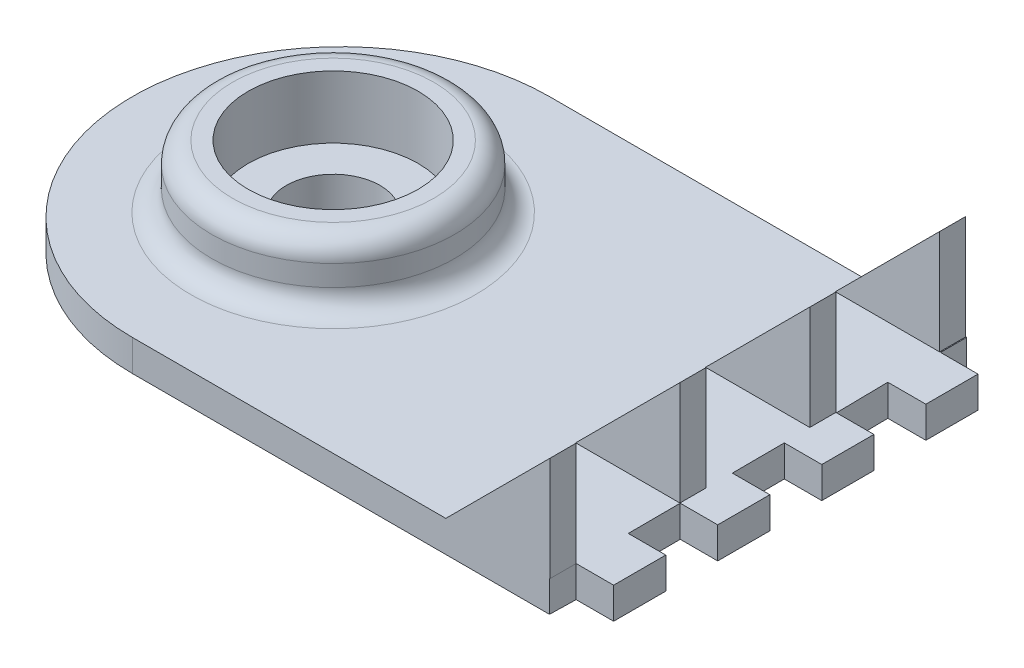
from build123d import *

# Parameters (mm, degrees)
BOSS_EXTRUDE1_DEPTH = 3
BOSS_EXTRUDE3_DEPTH = 2.5
LPATTERN2_COUNT     = 4
LPATTERN2_PITCH     = 12.5
SKETCH3_R           = 11.65
SKETCH3_R_2         = 8.15
BOSS_EXTRUDE4_DEPTH = 6
SKETCH4_R           = 4.5
CUT_EXTRUDE2_DEPTH  = 47.572524089
FILLET1_R           = 2
FILLET2_R           = 2


with BuildPart() as part:
    # Sketch1 → Boss-Extrude1 (new body)
    with BuildSketch(Plane(origin=(0, 0, 0), x_dir=(1, 0, 0), z_dir=(0, 1, 0))):
        with BuildLine():
            Line((20, 17.5), (23.592842073, 17.5))
            Line((23.592842073, 17.5), (23.592842073, 12.5))
            Line((23.592842073, 12.5), (19.944472227, 12.5))
            Line((19.944472227, 12.5), (20.019420438, 7.500018858))
            Line((20.019420438, 7.500018858), (23.612262511, 7.500018858))
            Line((23.612262511, 7.500018858), (23.612262511, 2.500018858))
            Line((23.612262511, 2.500018858), (20.019420438, 2.500018858))
            Line((20.019420438, 2.500018858), (20.038840876, -2.499962285))
            Line((20.038840876, -2.499962285), (23.63168295, -2.499962285))
            Line((23.63168295, -2.499962285), (23.63168295, -7.499962285))
            Line((23.63168295, -7.499962285), (20.038840876, -7.499962285))
            Line((20.038840876, -7.499962285), (20.058261315, -12.499943427))
            Line((20.058261315, -12.499943427), (23.651103388, -12.499943427))
            Line((23.651103388, -12.499943427), (23.651103388, -17.499943427))
            Line((23.651103388, -17.499943427), (20.058261315, -17.499943427))
            Line((20.058261315, -17.499943427), (20, -20))
            Line((20, -20), (-20, -20))
            ThreePointArc((-20, -20), (-40, 0), (-20, 20))
            Line((-20, 20), (20, 20))
            Line((20, 20), (20, 17.5))
        make_face()
    extrude(amount=BOSS_EXTRUDE1_DEPTH)

    # Sketch2 → Boss-Extrude3 (add)
    with BuildSketch(Plane.XY.offset(20)):
        Polygon((20.058261315, 3), (20.058261315, 13), (10.058261315, 3), align=None)
    boss_extrude3 = extrude(amount=-BOSS_EXTRUDE3_DEPTH)

    # LPattern2: Boss-Extrude3 ×4
    with Locations(*[Vector(-0.0038840729869411184, 0, -0.9999924569600674) * (i * LPATTERN2_PITCH) for i in range(1, LPATTERN2_COUNT)]):
        add(boss_extrude3)

    # Sketch3 → Boss-Extrude4 (add)
    with BuildSketch(Plane(origin=(0, 3, 0), x_dir=(1, 0, 0), z_dir=(0, 1, 0))):
        with Locations((-20.741708838, 0)):
            Circle(SKETCH3_R)
        with Locations((-20.741708838, 0)):
            Circle(SKETCH3_R_2, mode=Mode.SUBTRACT)
    extrude(amount=BOSS_EXTRUDE4_DEPTH)

    # Sketch4 → Cut-Extrude2 (cut, through all)
    with BuildSketch(Plane(origin=(0, 0, 0), x_dir=(1, 0, 0), z_dir=(0, 1, 0))):
        with Locations((-20.741708838, 0)):
            Circle(SKETCH4_R)
    extrude(amount=CUT_EXTRUDE2_DEPTH, mode=Mode.SUBTRACT)

    # Fillet1
    fillet1_edges = [part.edges().sort_by_distance(p)[0] for p in [
        (-32.391708838, 3, 0),
    ]]
    fillet(fillet1_edges, radius=FILLET1_R)

    # Fillet2
    fillet2_edges = [part.edges().sort_by_distance(p)[0] for p in [
        (-32.391708838, 9, 0),
    ]]
    fillet(fillet2_edges, radius=FILLET2_R)


solid = part.part
